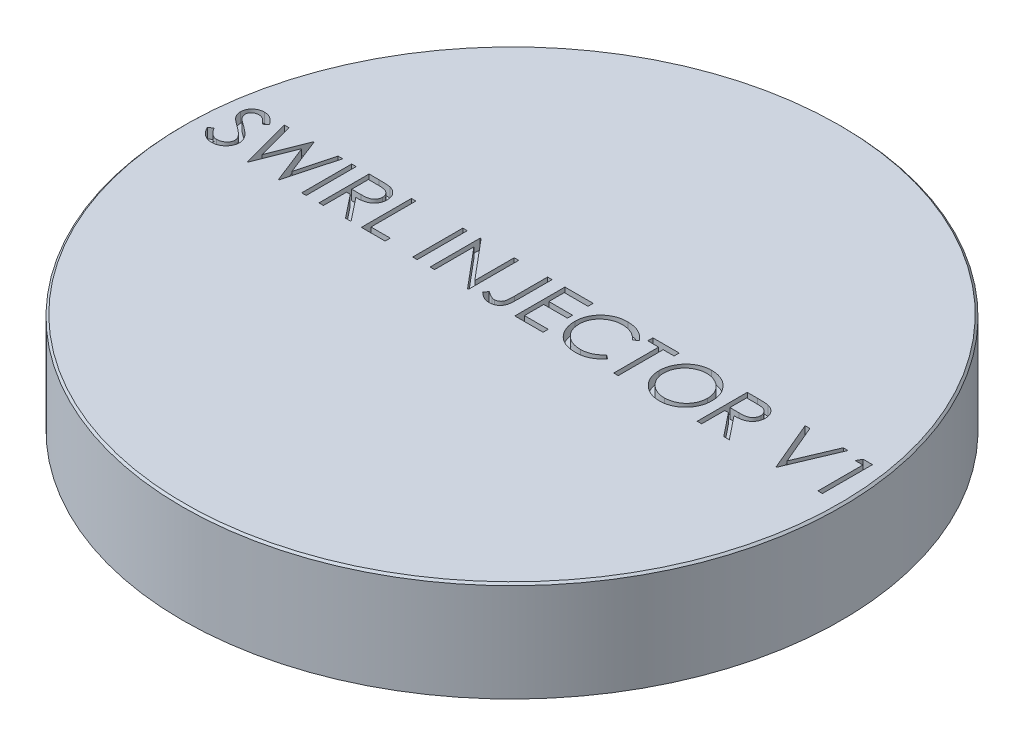
from build123d import *

# Parameters (mm, degrees)
SKETCH3_R           = 4.1783
BOSS_EXTRUDE1_DEPTH = 1.27
CHAMFER1_SIZE       = 0.0254
SKETCH4_W           = 0.056987179
SKETCH4_H           = 0.635
CUT_EXTRUDE1_DEPTH  = 0.127


with BuildPart() as part:
    # Sketch3 → Boss-Extrude1 (new body)
    with BuildSketch(Plane(origin=(0, 0, 0), x_dir=(1, 0, 0), z_dir=(0, 1, 0))):
        Circle(SKETCH3_R)
    extrude(amount=BOSS_EXTRUDE1_DEPTH)

    # Chamfer1
    chamfer1_edges = [part.edges().sort_by_distance(p)[0] for p in [
        (-4.1783, 1.27, 0),
    ]]
    chamfer(chamfer1_edges, length=CHAMFER1_SIZE)

    # Sketch4 → Cut-Extrude1 (cut)
    # profile 1 of 15: a face of its own
    with BuildSketch(Plane(origin=(0, 1.27, 0), x_dir=(1, 0, 0), z_dir=(0, 1, 0))):
        with BuildLine():
            Line((-3.985831527, 0.122496995), (-3.932151639, 0.154679487))
            add(Edge.make_bspline(
                [(-3.932151639, 0.154679487), (-3.927159045, 0.146322092), (-3.917593426, 0.130309644), (-3.901636537, 0.108672828), (-3.885102423, 0.090282837), (-3.867868644, 0.075246653), (-3.850040393, 0.06340864), (-3.831501287, 0.055026235), (-3.812313798, 0.049798194), (-3.79925569, 0.049163178), (-3.792736575, 0.048846154)],
                knots=[0, 0, 0, 0, 1.272034388, 2.437168799, 3.508375237, 4.49857839, 5.41946034, 6.295179144, 7.148887113, 8, 8, 8, 8], degree=3))
            add(Edge.make_bspline(
                [(-3.792736575, 0.048846154), (-3.787169102, 0.049001216), (-3.776131573, 0.049308627), (-3.759882423, 0.052262429), (-3.744101439, 0.056800344), (-3.729113872, 0.063299285), (-3.715126525, 0.071162124), (-3.702860739, 0.080659216), (-3.692256944, 0.091292057), (-3.683583004, 0.103154338), (-3.676928198, 0.115911878), (-3.671813351, 0.129006658), (-3.668974888, 0.142644384), (-3.668547306, 0.151826568), (-3.668331527, 0.156460337)],
                knots=[0, 0, 0, 0, 1.095163259, 2.171163733, 3.241058638, 4.321873601, 5.38011039, 6.391990106, 7.366004449, 8.327778327, 9.272591725, 10.192022065, 11.087607919, 12, 12, 12, 12], degree=3))
            add(Edge.make_bspline(
                [(-3.668331527, 0.156460337), (-3.668599009, 0.161747319), (-3.669142761, 0.172494983), (-3.673738615, 0.188351777), (-3.680968407, 0.204044), (-3.687638201, 0.213750658), (-3.691100958, 0.218790064)],
                knots=[0, 0, 0, 0, 0.938893495, 1.908633276, 2.914225137, 4, 4, 4, 4], degree=3))
            add(Edge.make_bspline(
                [(-3.691100958, 0.218790064), (-3.693944055, 0.222427131), (-3.699912782, 0.230062697), (-3.710173931, 0.241428333), (-3.72221464, 0.25315196), (-3.735622857, 0.265681246), (-3.750887003, 0.278433461), (-3.767528995, 0.292016705), (-3.785973723, 0.30591442), (-3.798909489, 0.315234871), (-3.805584131, 0.320044071)],
                knots=[0, 0, 0, 0, 0.722233717, 1.516239348, 2.393582979, 3.351407094, 4.387010283, 5.505090956, 6.712668013, 8, 8, 8, 8], degree=3))
            add(Edge.make_bspline(
                [(-3.805584131, 0.320044071), (-3.812265056, 0.324802686), (-3.825038476, 0.333900796), (-3.842901676, 0.347403487), (-3.858875457, 0.359748589), (-3.872888822, 0.371052317), (-3.884935606, 0.381316204), (-3.895110739, 0.390441687), (-3.90315502, 0.398675562), (-3.907628247, 0.404017062), (-3.909636615, 0.406415264)],
                knots=[0, 0, 0, 0, 1.452282411, 2.77665338, 3.964542531, 5.026858415, 5.96415736, 6.766646006, 7.446254459, 8, 8, 8, 8], degree=3))
            add(Edge.make_bspline(
                [(-3.909636615, 0.406415264), (-3.912443777, 0.410152881), (-3.917964437, 0.417503406), (-3.925251698, 0.428992344), (-3.931445518, 0.440753137), (-3.93630097, 0.452817387), (-3.940389684, 0.465015724), (-3.943139765, 0.477507307), (-3.944861776, 0.490236085), (-3.945038122, 0.498801963), (-3.945126399, 0.503089944)],
                knots=[0, 0, 0, 0, 1.068054152, 2.10047183, 3.106115577, 4.101338837, 5.06977816, 6.043150881, 7.020423561, 8, 8, 8, 8], degree=3))
            add(Edge.make_bspline(
                [(-3.945126399, 0.503089944), (-3.944889597, 0.509808203), (-3.944421054, 0.523101123), (-3.94045856, 0.542519574), (-3.934204192, 0.56105911), (-3.92544212, 0.578536184), (-3.914146857, 0.594495727), (-3.901075659, 0.609121316), (-3.885507003, 0.621416473), (-3.868425027, 0.632159233), (-3.849727657, 0.640567708), (-3.830135022, 0.646910628), (-3.809615982, 0.650504594), (-3.795717984, 0.651020352), (-3.788666062, 0.651282051)],
                knots=[0, 0, 0, 0, 1.005424448, 1.989358655, 2.955360095, 3.929531133, 4.905563448, 5.876582895, 6.856512386, 7.866279853, 8.892233794, 9.918561126, 10.94386622, 12, 12, 12, 12], degree=3))
            add(Edge.make_bspline(
                [(-3.788666062, 0.651282051), (-3.781183204, 0.65102396), (-3.766302187, 0.650510698), (-3.744412973, 0.646048003), (-3.7233381, 0.638663738), (-3.706384822, 0.630283796), (-3.693116449, 0.621914239), (-3.682997682, 0.614290643), (-3.672743802, 0.605514016), (-3.662272098, 0.595560981), (-3.651760006, 0.584340213), (-3.641051466, 0.57192856), (-3.630121434, 0.55840187), (-3.623090014, 0.548745425), (-3.619485373, 0.543795072)],
                knots=[0, 0, 0, 0, 1.286793592, 2.559021753, 3.825965368, 5.121522368, 5.803751409, 6.523245864, 7.299691795, 8.125521123, 9.008227632, 9.944561021, 10.946284179, 12, 12, 12, 12], degree=3))
            Line((-3.619485373, 0.543795072), (-3.671002801, 0.50474359))
            add(Edge.make_bspline(
                [(-3.671002801, 0.50474359), (-3.674113563, 0.508751109), (-3.680104163, 0.516468655), (-3.689199085, 0.527276594), (-3.697771339, 0.537149298), (-3.706216912, 0.545724542), (-3.714089756, 0.553471929), (-3.721730991, 0.560104914), (-3.729030652, 0.565688486), (-3.738232149, 0.571647246), (-3.749792363, 0.577553926), (-3.764303844, 0.582552116), (-3.779468782, 0.585555677), (-3.789797444, 0.585952804), (-3.795026239, 0.586153846)],
                knots=[0, 0, 0, 0, 1.181633172, 2.275549214, 3.290209073, 4.226197932, 5.078386478, 5.862611352, 6.581680152, 7.217281963, 8.414376989, 9.595101626, 10.782541182, 12, 12, 12, 12], degree=3))
            add(Edge.make_bspline(
                [(-3.795026239, 0.586153846), (-3.801586065, 0.585934009), (-3.814236072, 0.585510074), (-3.832195729, 0.58088002), (-3.848359912, 0.573589882), (-3.862248735, 0.563372736), (-3.873812444, 0.551267642), (-3.882177291, 0.537337764), (-3.887211964, 0.521955814), (-3.887826332, 0.511225827), (-3.888139219, 0.505761218)],
                knots=[0, 0, 0, 0, 1.14458467, 2.207223713, 3.21896685, 4.227309161, 5.202851033, 6.127160689, 7.046193047, 8, 8, 8, 8], degree=3))
            add(Edge.make_bspline(
                [(-3.888139219, 0.505761218), (-3.888067895, 0.502359164), (-3.88792513, 0.495549493), (-3.885933988, 0.485489021), (-3.883375967, 0.475453963), (-3.879322375, 0.465489438), (-3.873726155, 0.455421175), (-3.866377359, 0.445075803), (-3.857122087, 0.434362136), (-3.8500324, 0.427393941), (-3.846289259, 0.423714944)],
                knots=[0, 0, 0, 0, 0.858281714, 1.717966888, 2.583508476, 3.4729293, 4.427298488, 5.488583878, 6.674047936, 8, 8, 8, 8], degree=3))
            add(Edge.make_bspline(
                [(-3.846289259, 0.423714944), (-3.844899268, 0.422474512), (-3.841596965, 0.41952753), (-3.835559761, 0.414702931), (-3.827587282, 0.40875157), (-3.817887712, 0.401387872), (-3.806282205, 0.392845949), (-3.792769485, 0.383235022), (-3.777500178, 0.372243089), (-3.766664916, 0.364558221), (-3.760935694, 0.360494792)],
                knots=[0, 0, 0, 0, 0.420754252, 0.999615792, 1.744751191, 2.668019286, 3.750313428, 4.999500688, 6.413464383, 8, 8, 8, 8], degree=3))
            add(Edge.make_bspline(
                [(-3.760935694, 0.360494792), (-3.754043964, 0.355479859), (-3.740699084, 0.345769138), (-3.721711209, 0.331179436), (-3.704494761, 0.316910484), (-3.688989294, 0.303053403), (-3.675041626, 0.289713307), (-3.662806497, 0.276729701), (-3.652159237, 0.264195604), (-3.640696722, 0.248126008), (-3.628984089, 0.228390012), (-3.618925416, 0.204209531), (-3.612582973, 0.179935056), (-3.611753569, 0.163619758), (-3.611344348, 0.155569912)],
                knots=[0, 0, 0, 0, 1.163667725, 2.253281268, 3.268753668, 4.215851969, 5.092017293, 5.902905408, 6.650798638, 7.335211899, 8.59617414, 9.77448103, 10.901945474, 12, 12, 12, 12], degree=3))
            add(Edge.make_bspline(
                [(-3.611344348, 0.155569912), (-3.611463571, 0.14987698), (-3.611699703, 0.138601669), (-3.61441404, 0.122045391), (-3.618390894, 0.105965219), (-3.624384792, 0.090559917), (-3.631700565, 0.075547653), (-3.640983584, 0.061322219), (-3.651743693, 0.047568773), (-3.664086962, 0.034654054), (-3.677593575, 0.022798387), (-3.691869046, 0.012252114), (-3.706936738, 0.003458575), (-3.722714913, -0.003717077), (-3.739207194, -0.009329301), (-3.756408035, -0.013395636), (-3.774345789, -0.015891315), (-3.786537876, -0.016150352), (-3.792736575, -0.016282051)],
                knots=[0, 0, 0, 0, 0.983748083, 1.948392443, 2.894712957, 3.844097841, 4.80183111, 5.778335162, 6.776009319, 7.81870978, 8.863265674, 9.881300176, 10.883814829, 11.87499822, 12.874611388, 13.892143829, 14.928324115, 16, 16, 16, 16], degree=3))
            add(Edge.make_bspline(
                [(-3.792736575, -0.016282051), (-3.797532702, -0.016189308), (-3.807064552, -0.01600499), (-3.821163273, -0.01437553), (-3.83497717, -0.012070098), (-3.848332904, -0.008409945), (-3.861402548, -0.003969122), (-3.874129261, 0.001498832), (-3.886519209, 0.008051525), (-3.898641828, 0.015543622), (-3.910466285, 0.02426267), (-3.921881674, 0.034417861), (-3.933262541, 0.045729117), (-3.944272969, 0.058503605), (-3.955135668, 0.072534943), (-3.965636465, 0.087954409), (-3.975992719, 0.104678015), (-3.982490668, 0.116446395), (-3.985831527, 0.122496995)],
                knots=[0, 0, 0, 0, 0.915332311, 1.819136955, 2.706846663, 3.586547465, 4.459518054, 5.340707479, 6.227863349, 7.133153174, 8.059268498, 9.028702269, 10.047606654, 11.120612155, 12.245963614, 13.433783089, 14.680604001, 16, 16, 16, 16], degree=3))
        make_face()
    # profile 2 of 15: a face of its own
    with BuildSketch(Plane(origin=(0, 1.27, 0), x_dir=(1, 0, 0), z_dir=(0, 1, 0))):
        Polygon((-3.521793066, 0.635), (-3.462897833, 0.635), (-3.338619989, 0.169307893), (-3.153793266, 0.635), (-3.145525037, 0.635), (-2.964132809, 0.172487981), (-2.839218947, 0.635), (-2.780959732, 0.635), (-2.952175678, 0), (-2.960316703, 0), (-3.151376399, 0.485663061), (-3.344725758, 0), (-3.352866783, 0), align=None)
    # profile 3 of 15: a face of its own
    with BuildSketch(Plane(origin=(0, 1.27, 0), x_dir=(1, 0, 0), z_dir=(0, 1, 0))):
        with Locations((-2.638491784, 0.3175)):
            Rectangle(SKETCH4_W, SKETCH4_H)
    # profile 4 of 15: a face of its own
    with BuildSketch(Plane(origin=(0, 1.27, 0), x_dir=(1, 0, 0), z_dir=(0, 1, 0))):
        with BuildLine():
            Line((-2.447177681, 0.635), (-2.320101359, 0.635))
            add(Edge.make_bspline(
                [(-2.320101359, 0.635), (-2.311621183, 0.634971772), (-2.295338305, 0.634917572), (-2.27201144, 0.634615355), (-2.250815667, 0.63374915), (-2.231762068, 0.633003736), (-2.214850992, 0.631644484), (-2.200030583, 0.630345338), (-2.187369101, 0.628644688), (-2.179704496, 0.627065275), (-2.176234171, 0.62635016)],
                knots=[0, 0, 0, 0, 1.410062039, 2.707475311, 3.878576406, 4.937260626, 5.877586885, 6.699081471, 7.410979367, 8, 8, 8, 8], degree=3))
            add(Edge.make_bspline(
                [(-2.176234171, 0.62635016), (-2.171588398, 0.625202304), (-2.162395959, 0.622931079), (-2.149160732, 0.618130552), (-2.136548848, 0.612575277), (-2.124612694, 0.60605043), (-2.113412058, 0.598507578), (-2.10283145, 0.590076932), (-2.092822859, 0.580804625), (-2.083791048, 0.570456875), (-2.075274963, 0.559600823), (-2.068092455, 0.547861713), (-2.061900937, 0.535585978), (-2.056971429, 0.522648775), (-2.053002139, 0.509175568), (-2.050203379, 0.495044315), (-2.048524949, 0.480319395), (-2.04835407, 0.470275889), (-2.048267425, 0.465183293)],
                knots=[0, 0, 0, 0, 1.027469482, 2.033020251, 3.019912614, 3.986113645, 4.951240523, 5.91722682, 6.890402269, 7.87763091, 8.8651537, 9.85103654, 10.82876324, 11.815024772, 12.821070561, 13.842952187, 14.906261191, 16, 16, 16, 16], degree=3))
            add(Edge.make_bspline(
                [(-2.048267425, 0.465183293), (-2.048533943, 0.456722353), (-2.049053989, 0.440212867), (-2.053902686, 0.41625325), (-2.061844998, 0.393903188), (-2.072789366, 0.373190824), (-2.086726614, 0.354519893), (-2.103476968, 0.338120481), (-2.123049775, 0.32439724), (-2.141270522, 0.314880803), (-2.157365813, 0.308786089), (-2.170616143, 0.304497778), (-2.185070009, 0.301184536), (-2.200588925, 0.298216341), (-2.217237474, 0.295975391), (-2.234975752, 0.29433408), (-2.253816411, 0.293308274), (-2.266759357, 0.29315551), (-2.273417665, 0.293076923)],
                knots=[0, 0, 0, 0, 1.260483769, 2.459530307, 3.627416485, 4.787058657, 5.939039949, 7.08810263, 8.267026773, 9.491475466, 10.141966685, 10.831826277, 11.566392101, 12.351337768, 13.187381173, 14.07005841, 15.007169909, 16, 16, 16, 16], degree=3))
            Line((-2.273417665, 0.293076923), (-2.040126399, 0))
            Line((-2.040126399, 0), (-2.110597152, 0))
            Line((-2.110597152, 0), (-2.343888418, 0.293076923))
            Line((-2.343888418, 0.293076923), (-2.390190501, 0.293076923))
            Line((-2.390190501, 0.293076923), (-2.390190501, 0))
            Line((-2.390190501, 0), (-2.447177681, 0))
            Line((-2.447177681, 0), (-2.447177681, 0.635))
        make_face()
        with BuildLine():
            Line((-2.390190501, 0.569871795), (-2.390190501, 0.358205128))
            Line((-2.390190501, 0.358205128), (-2.273926479, 0.357314704))
            add(Edge.make_bspline(
                [(-2.273926479, 0.357314704), (-2.268498129, 0.357312302), (-2.257976441, 0.357307647), (-2.242754463, 0.358032232), (-2.228581243, 0.35885652), (-2.215510992, 0.36011733), (-2.203537872, 0.361742217), (-2.192667867, 0.363774759), (-2.182883233, 0.366142776), (-2.171471641, 0.369807928), (-2.158728728, 0.375614734), (-2.14488002, 0.384063046), (-2.133086739, 0.394689158), (-2.123123069, 0.406840056), (-2.11511673, 0.420199775), (-2.109472114, 0.434608174), (-2.105890271, 0.449701507), (-2.105467806, 0.460075249), (-2.105254604, 0.465310497)],
                knots=[0, 0, 0, 0, 1.146690395, 2.22261258, 3.21895312, 4.145990853, 4.996080663, 5.770904154, 6.481378293, 7.121626537, 8.300444488, 9.431385265, 10.535395872, 11.636531494, 12.74115979, 13.810798291, 14.895190096, 16, 16, 16, 16], degree=3))
            add(Edge.make_bspline(
                [(-2.105254604, 0.465310497), (-2.105472703, 0.470417089), (-2.105904896, 0.480536493), (-2.109433458, 0.495351208), (-2.115400532, 0.509333355), (-2.123441852, 0.522426054), (-2.133238842, 0.534310666), (-2.144726502, 0.544479221), (-2.15759073, 0.552870195), (-2.169614219, 0.558232204), (-2.180360998, 0.561519663), (-2.189691807, 0.563833089), (-2.20023489, 0.565691728), (-2.212041437, 0.567180905), (-2.225061047, 0.568460873), (-2.239359551, 0.569322982), (-2.254842081, 0.569833497), (-2.265573025, 0.569858732), (-2.271128001, 0.569871795)],
                knots=[0, 0, 0, 0, 1.101028733, 2.181837193, 3.264309656, 4.369019818, 5.486613113, 6.575447106, 7.666700264, 8.788928104, 9.402425223, 10.0903467, 10.862060571, 11.710948788, 12.657782767, 13.684531032, 14.801375019, 16, 16, 16, 16], degree=3))
            Line((-2.271128001, 0.569871795), (-2.390190501, 0.569871795))
        make_face(mode=Mode.SUBTRACT)
    # profile 5 of 15: a face of its own
    with BuildSketch(Plane(origin=(0, 1.27, 0), x_dir=(1, 0, 0), z_dir=(0, 1, 0))):
        Polygon((-1.909869989, 0.635), (-1.852882809, 0.635), (-1.852882809, 0.065128205), (-1.60865204, 0.065128205), (-1.60865204, 0), (-1.909869989, 0), align=None)
    # profile 6 of 15: a face of its own
    with BuildSketch(Plane(origin=(0, 1.27, 0), x_dir=(1, 0, 0), z_dir=(0, 1, 0))):
        with Locations((-1.230094348, 0.3175)):
            Rectangle(SKETCH4_W, SKETCH4_H)
    # profile 7 of 15: a face of its own
    with BuildSketch(Plane(origin=(0, 1.27, 0), x_dir=(1, 0, 0), z_dir=(0, 1, 0))):
        Polygon((-1.038780245, 0), (-1.038780245, 0.635), (-1.026823114, 0.635), (-0.607305886, 0.135217348), (-0.607305886, 0.635), (-0.550318707, 0.635), (-0.550318707, 0), (-0.563293466, 0), (-0.981793066, 0.498637821), (-0.981793066, 0), align=None)
    # profile 8 of 15: a face of its own
    with BuildSketch(Plane(origin=(0, 1.27, 0), x_dir=(1, 0, 0), z_dir=(0, 1, 0))):
        with BuildLine():
            Line((-0.183972553, 0.635), (-0.126985373, 0.635))
            Line((-0.126985373, 0.635), (-0.126985373, 0.206196915))
            add(Edge.make_bspline(
                [(-0.126985373, 0.206196915), (-0.127042327, 0.198267548), (-0.127151685, 0.183042197), (-0.127753014, 0.161112218), (-0.128865802, 0.141087822), (-0.130486869, 0.122923476), (-0.13264954, 0.106676084), (-0.135124412, 0.092220106), (-0.138120305, 0.079676192), (-0.142631793, 0.06559092), (-0.150029352, 0.050143401), (-0.161163086, 0.03346011), (-0.174993893, 0.018867191), (-0.191014224, 0.006193911), (-0.209364095, -0.003903901), (-0.229665629, -0.011152912), (-0.251793853, -0.015574482), (-0.267142567, -0.016041462), (-0.275050277, -0.016282051)],
                knots=[0, 0, 0, 0, 1.237770943, 2.376671248, 3.424123796, 4.367912054, 5.222547132, 5.982086412, 6.656319012, 7.234008312, 8.288027371, 9.317870876, 10.352700517, 11.413286737, 12.494591526, 13.606319346, 14.766767577, 16, 16, 16, 16], degree=3))
            add(Edge.make_bspline(
                [(-0.275050277, -0.016282051), (-0.281211293, -0.016085998), (-0.293607667, -0.015691526), (-0.312057267, -0.0124763), (-0.330454482, -0.00752039), (-0.348896959, -0.000262776), (-0.367749065, 0.009607954), (-0.387266125, 0.022522914), (-0.407699189, 0.038458062), (-0.421158157, 0.050620624), (-0.428203322, 0.056987179)],
                knots=[0, 0, 0, 0, 0.848567217, 1.707373443, 2.573483905, 3.470863513, 4.432650262, 5.500696352, 6.691726801, 8, 8, 8, 8], degree=3))
            Line((-0.428203322, 0.056987179), (-0.394621591, 0.105833333))
            add(Edge.make_bspline(
                [(-0.394621591, 0.105833333), (-0.386874105, 0.100490734), (-0.372245841, 0.090403211), (-0.35074575, 0.077426242), (-0.331696266, 0.066300105), (-0.319235217, 0.060630048), (-0.313465742, 0.058004808)],
                knots=[0, 0, 0, 0, 1.196737151, 2.259595785, 3.194191475, 4, 4, 4, 4], degree=3))
            add(Edge.make_bspline(
                [(-0.313465742, 0.058004808), (-0.309967017, 0.056633306), (-0.303105238, 0.053943486), (-0.292614116, 0.050941588), (-0.282182874, 0.049301036), (-0.275267235, 0.048995994), (-0.271870189, 0.048846154)],
                knots=[0, 0, 0, 0, 1.051806502, 2.062826769, 3.048436908, 4, 4, 4, 4], degree=3))
            add(Edge.make_bspline(
                [(-0.271870189, 0.048846154), (-0.26748274, 0.049031707), (-0.258810372, 0.049398478), (-0.246207618, 0.052636846), (-0.234150233, 0.057579759), (-0.223070452, 0.06481718), (-0.212858675, 0.073422595), (-0.204432619, 0.083828613), (-0.197408205, 0.095361299), (-0.193180975, 0.10627812), (-0.190487709, 0.116234309), (-0.188778357, 0.12538432), (-0.187283628, 0.136081617), (-0.18598069, 0.148338968), (-0.185217879, 0.162180912), (-0.18436203, 0.177566807), (-0.184052647, 0.194535442), (-0.184000066, 0.206366572), (-0.183972553, 0.212557091)],
                knots=[0, 0, 0, 0, 0.997221856, 1.971139923, 2.944579524, 3.951425367, 4.971190333, 5.972282193, 6.985401279, 8.033996657, 8.624075553, 9.332086008, 10.151144245, 11.082816738, 12.137127781, 13.306538797, 14.590673636, 16, 16, 16, 16], degree=3))
            Line((-0.183972553, 0.212557091), (-0.183972553, 0.635))
        make_face()
    # profile 9 of 15: a face of its own
    with BuildSketch(Plane(origin=(0, 1.27, 0), x_dir=(1, 0, 0), z_dir=(0, 1, 0))):
        Polygon((0.03583514, 0.635), (0.394040268, 0.635), (0.394040268, 0.569871795), (0.092822319, 0.569871795), (0.092822319, 0.374487179), (0.394040268, 0.374487179), (0.394040268, 0.309358974), (0.092822319, 0.309358974), (0.092822319, 0.065128205), (0.394040268, 0.065128205), (0.394040268, 0), (0.03583514, 0), align=None)
    # profile 10 of 15: a face of its own
    with BuildSketch(Plane(origin=(0, 1.27, 0), x_dir=(1, 0, 0), z_dir=(0, 1, 0))):
        with BuildLine():
            Line((1.094168473, 0.518481571), (1.044304691, 0.480320513))
            add(Edge.make_bspline(
                [(1.044304691, 0.480320513), (1.040747623, 0.484559767), (1.033681443, 0.492981122), (1.022313273, 0.504806554), (1.01046569, 0.515885537), (0.99814322, 0.526270849), (0.985124066, 0.53559932), (0.971723607, 0.544357077), (0.957717676, 0.552207081), (0.938349861, 0.561725365), (0.913013751, 0.571657882), (0.881119545, 0.57998604), (0.847825388, 0.585287596), (0.825110967, 0.585861789), (0.813557495, 0.586153846)],
                knots=[0, 0, 0, 0, 0.757959112, 1.505699292, 2.245454638, 2.979532153, 3.711538275, 4.438200793, 5.171680507, 5.909471876, 7.393775596, 8.890124382, 10.418191784, 12, 12, 12, 12], degree=3))
            add(Edge.make_bspline(
                [(0.813557495, 0.586153846), (0.807192382, 0.586080556), (0.794521231, 0.585934655), (0.775716436, 0.584009857), (0.757262783, 0.581304537), (0.739172274, 0.577290372), (0.721467937, 0.572215339), (0.70403403, 0.566151014), (0.687122964, 0.558648065), (0.670500798, 0.55035528), (0.654575141, 0.540988587), (0.639506583, 0.530771736), (0.62535008, 0.519819057), (0.612094434, 0.508089499), (0.599726095, 0.495635886), (0.588334683, 0.482325498), (0.577959616, 0.46820089), (0.568395241, 0.453448315), (0.559829503, 0.438110744), (0.552657653, 0.42213141), (0.546306724, 0.405783951), (0.54128129, 0.388883669), (0.537303556, 0.371549481), (0.534558966, 0.353734867), (0.532656057, 0.335477042), (0.532510882, 0.323101924), (0.532437704, 0.316863982)],
                knots=[0, 0, 0, 0, 1.054917814, 2.100044995, 3.131103042, 4.146048494, 5.169673617, 6.183595914, 7.203665975, 8.234915748, 9.262203917, 10.264457458, 11.251630812, 12.227803204, 13.197192746, 14.159520551, 15.12972552, 16.100847026, 17.073214652, 18.039054194, 19.002613845, 19.979014051, 20.95965708, 21.949030935, 22.966165397, 24, 24, 24, 24], degree=3))
            add(Edge.make_bspline(
                [(0.532437704, 0.316863982), (0.532666634, 0.307478443), (0.533116107, 0.289051181), (0.537116305, 0.262059942), (0.543195086, 0.236202619), (0.552305626, 0.211640848), (0.563539511, 0.18807176), (0.577734594, 0.16589414), (0.594175023, 0.144772849), (0.613093382, 0.125207057), (0.633849865, 0.107333852), (0.656119844, 0.091594818), (0.67984785, 0.078474832), (0.704771896, 0.067557196), (0.731083777, 0.059164904), (0.758736176, 0.053256842), (0.787668953, 0.049402904), (0.807439115, 0.049033934), (0.817500805, 0.048846154)],
                knots=[0, 0, 0, 0, 1.029171465, 2.020641659, 2.987623507, 3.938342917, 4.889210282, 5.84687017, 6.821220943, 7.821438502, 8.827599549, 9.822697543, 10.807740252, 11.797342354, 12.80366471, 13.83203677, 14.896651826, 16, 16, 16, 16], degree=3))
            add(Edge.make_bspline(
                [(0.817500805, 0.048846154), (0.828586578, 0.049152547), (0.850406033, 0.049755601), (0.882404232, 0.054864494), (0.913035863, 0.063148144), (0.942302576, 0.074741053), (0.970121861, 0.08981147), (0.996537255, 0.108080942), (1.021571055, 0.129723254), (1.036624416, 0.146248335), (1.044304691, 0.154679487)],
                knots=[0, 0, 0, 0, 1.028121516, 2.023589091, 2.998037872, 3.967518031, 4.937445131, 5.927275754, 6.942489185, 8, 8, 8, 8], degree=3))
            Line((1.044304691, 0.154679487), (1.094168473, 0.11690004))
            add(Edge.make_bspline(
                [(1.094168473, 0.11690004), (1.090155616, 0.11172235), (1.082149123, 0.101391769), (1.069184597, 0.086828188), (1.055527145, 0.073129598), (1.041075323, 0.060406444), (1.025995381, 0.048404134), (1.010016547, 0.037463659), (0.99334888, 0.027432313), (0.976048853, 0.018247142), (0.958134847, 0.01009787), (0.939628328, 0.003121258), (0.920609067, -0.002888543), (0.901076193, -0.007832823), (0.880989192, -0.011692006), (0.860420548, -0.014271861), (0.839325871, -0.016039323), (0.825094356, -0.016200416), (0.817882415, -0.016282051)],
                knots=[0, 0, 0, 0, 0.986787822, 1.968848986, 2.935600012, 3.899624008, 4.868462664, 5.837806735, 6.815139263, 7.798259679, 8.787526145, 9.778297419, 10.776456485, 11.791383307, 12.812564526, 13.85620153, 14.913611965, 16, 16, 16, 16], degree=3))
            add(Edge.make_bspline(
                [(0.817882415, -0.016282051), (0.811052778, -0.016234518), (0.797548018, -0.016140528), (0.777609244, -0.014617949), (0.758198277, -0.012540639), (0.739370595, -0.009412787), (0.721023454, -0.005721743), (0.703323176, -0.000773957), (0.686095588, 0.004768534), (0.669409904, 0.011282725), (0.65325193, 0.018633518), (0.637673781, 0.026941415), (0.622682622, 0.036136553), (0.608131068, 0.046016248), (0.594234077, 0.056897844), (0.580871223, 0.068630219), (0.567967574, 0.08117383), (0.55998423, 0.090218925), (0.555970356, 0.094766627)],
                knots=[0, 0, 0, 0, 1.114604814, 2.203992996, 3.262667896, 4.300477797, 5.318619304, 6.316056647, 7.298880507, 8.271930387, 9.238335007, 10.195173496, 11.151986948, 12.108099108, 13.064862484, 14.031167946, 15.010108607, 16, 16, 16, 16], degree=3))
            add(Edge.make_bspline(
                [(0.555970356, 0.094766627), (0.549541318, 0.102666242), (0.536760858, 0.118370103), (0.520409484, 0.143821988), (0.506412714, 0.170395506), (0.495095939, 0.198230264), (0.486248986, 0.227263804), (0.480120112, 0.257510762), (0.476137464, 0.288942889), (0.475682026, 0.310321849), (0.475450524, 0.321188902)],
                knots=[0, 0, 0, 0, 0.994628077, 1.977248131, 2.950237994, 3.925870899, 4.908910175, 5.911660606, 6.938484602, 8, 8, 8, 8], degree=3))
            add(Edge.make_bspline(
                [(0.475450524, 0.321188902), (0.475732681, 0.33261082), (0.476287806, 0.355082731), (0.481004186, 0.38806172), (0.488591311, 0.419657759), (0.499367603, 0.449811867), (0.513030146, 0.478682646), (0.529907831, 0.506049551), (0.549804584, 0.532087599), (0.572564357, 0.556401704), (0.597523002, 0.578633843), (0.624250844, 0.598192969), (0.652695569, 0.614470289), (0.682543808, 0.628076736), (0.714019067, 0.638535089), (0.747054193, 0.64585631), (0.78158711, 0.650413272), (0.805147864, 0.650989346), (0.817119194, 0.651282051)],
                knots=[0, 0, 0, 0, 1.032925535, 2.032216505, 3.007276963, 3.968222605, 4.92396291, 5.891752235, 6.871517503, 7.883894988, 8.900124299, 9.891468569, 10.874487609, 11.85992873, 12.854644235, 13.869047385, 14.917252991, 16, 16, 16, 16], degree=3))
            add(Edge.make_bspline(
                [(0.817119194, 0.651282051), (0.824415248, 0.651194578), (0.838857053, 0.651021432), (0.860220748, 0.649333032), (0.881020142, 0.646518421), (0.901269563, 0.642687363), (0.921067523, 0.637932606), (0.94026271, 0.63173858), (0.958967757, 0.624656238), (0.977064696, 0.616499488), (0.994466699, 0.607343379), (1.011168345, 0.597289401), (1.02703697, 0.58635002), (1.042184232, 0.574618272), (1.056356745, 0.561845962), (1.069956899, 0.548384398), (1.082522837, 0.533845833), (1.090279488, 0.523612366), (1.094168473, 0.518481571)],
                knots=[0, 0, 0, 0, 1.096760587, 2.17092713, 3.219439832, 4.250915756, 5.268269357, 6.278326846, 7.281116186, 8.274029601, 9.260640565, 10.235837813, 11.203064059, 12.156899882, 13.114053108, 14.069676657, 15.032185724, 16, 16, 16, 16], degree=3))
        make_face()
    # profile 11 of 15: a face of its own
    with BuildSketch(Plane(origin=(0, 1.27, 0), x_dir=(1, 0, 0), z_dir=(0, 1, 0))):
        Polygon((1.151155652, 0.569871795), (1.151155652, 0.635), (1.484937704, 0.635), (1.484937704, 0.569871795), (1.346540268, 0.569871795), (1.346540268, 0), (1.289553088, 0), (1.289553088, 0.569871795), align=None)
    # profile 12 of 15: a face of its own
    with BuildSketch(Plane(origin=(0, 1.27, 0), x_dir=(1, 0, 0), z_dir=(0, 1, 0))):
        with BuildLine():
            add(Edge.make_bspline(
                [(1.879777447, 0.651282051), (1.891535489, 0.65098424), (1.914629254, 0.650399314), (1.948569986, 0.64592182), (1.980972239, 0.638175656), (2.012099964, 0.627859086), (2.041580832, 0.614096934), (2.069636746, 0.597462628), (2.09620095, 0.577781899), (2.120915401, 0.555206882), (2.143531733, 0.530644456), (2.163457287, 0.504432035), (2.180156388, 0.476728109), (2.19386981, 0.44761593), (2.204628272, 0.417161336), (2.212052156, 0.385201967), (2.216794363, 0.351944896), (2.217348768, 0.32926145), (2.217630011, 0.317754407)],
                knots=[0, 0, 0, 0, 1.065120563, 2.091984664, 3.0946048, 4.079830382, 5.057816894, 6.036188127, 7.030412546, 8.04752943, 9.064399622, 10.05169764, 11.02544977, 11.989514704, 12.962713494, 13.945757189, 14.957906945, 16, 16, 16, 16], degree=3))
            add(Edge.make_bspline(
                [(2.217630011, 0.317754407), (2.217348809, 0.306332127), (2.216794528, 0.283817491), (2.212046764, 0.250771466), (2.204600754, 0.219005011), (2.193969717, 0.188571157), (2.180321666, 0.159437799), (2.16351137, 0.131681595), (2.143710036, 0.105293444), (2.121175365, 0.080562432), (2.096609747, 0.05788432), (2.070260827, 0.038123324), (2.042721182, 0.02111909), (2.013636421, 0.007551195), (1.983392271, -0.00329314), (1.95171805, -0.010686831), (1.918762175, -0.015456052), (1.896288436, -0.016003697), (1.884865588, -0.016282051)],
                knots=[0, 0, 0, 0, 1.043624062, 2.057103931, 3.04512605, 4.022047818, 4.998200453, 5.980619268, 6.982898556, 8.009068085, 9.034988726, 10.034168286, 11.015286542, 11.987931943, 12.962482838, 13.94673481, 14.956375938, 16, 16, 16, 16], degree=3))
            add(Edge.make_bspline(
                [(1.884865588, -0.016282051), (1.873358605, -0.016000948), (1.850675277, -0.015446819), (1.817376415, -0.010696764), (1.785394596, -0.003268842), (1.754821278, 0.007346441), (1.725639412, 0.021065567), (1.697791925, 0.037794076), (1.671390594, 0.057643657), (1.646654306, 0.080171022), (1.624021237, 0.104695003), (1.604289179, 0.130972075), (1.587556909, 0.158486708), (1.573883847, 0.187315259), (1.563059009, 0.217318364), (1.555673992, 0.248696159), (1.550895898, 0.281269755), (1.55034529, 0.303448109), (1.550065909, 0.314701522)],
                knots=[0, 0, 0, 0, 1.053102029, 2.075944431, 3.073151272, 4.055350789, 5.033113405, 6.020478099, 7.024410459, 8.052272461, 9.079885166, 10.07527673, 11.055994387, 12.023226415, 12.992069828, 13.970394897, 14.97016774, 16, 16, 16, 16], degree=3))
            add(Edge.make_bspline(
                [(1.550065909, 0.314701522), (1.550162907, 0.322254878), (1.55035568, 0.337266301), (1.552676458, 0.359557812), (1.556044081, 0.381490832), (1.560870428, 0.403002989), (1.56718263, 0.424041625), (1.574630641, 0.444751835), (1.583727442, 0.464923739), (1.594010931, 0.484652897), (1.60548843, 0.50363176), (1.618165888, 0.521571342), (1.631598019, 0.53862218), (1.646323377, 0.554342422), (1.661856647, 0.569189385), (1.678449809, 0.582934907), (1.696001617, 0.595702934), (1.714587591, 0.607209195), (1.733749764, 0.617615781), (1.753503122, 0.626546031), (1.773579386, 0.634210674), (1.794072586, 0.640422938), (1.814928304, 0.645327322), (1.836192056, 0.648666942), (1.857846903, 0.650993639), (1.872435814, 0.6511855), (1.879777447, 0.651282051)],
                knots=[0, 0, 0, 0, 1.037015668, 2.060948919, 3.074880161, 4.083647147, 5.086022904, 6.090072063, 7.104153813, 8.122640571, 9.144368836, 10.147691507, 11.138137339, 12.123020368, 13.103399296, 14.087645067, 15.080126199, 16.082011238, 17.087798457, 18.072939717, 19.057185487, 20.037253025, 21.01195951, 21.997135196, 22.992090687, 24, 24, 24, 24], degree=3))
        make_face()
        with BuildLine():
            add(Edge.make_bspline(
                [(1.882575925, 0.586153846), (1.876549841, 0.586080387), (1.864555284, 0.585934172), (1.846723661, 0.584008178), (1.829126553, 0.581263184), (1.811760326, 0.57734768), (1.794697642, 0.572012944), (1.777779457, 0.565873237), (1.761160045, 0.558394553), (1.744894274, 0.549944934), (1.729125396, 0.540592487), (1.714245949, 0.530256181), (1.700217412, 0.519178414), (1.687074134, 0.507333335), (1.674854707, 0.494660622), (1.663318625, 0.481352394), (1.652928287, 0.467028265), (1.643405903, 0.452076663), (1.634884595, 0.436517062), (1.627307167, 0.420513272), (1.621108839, 0.403934749), (1.616053808, 0.386961352), (1.611862843, 0.369619963), (1.609207831, 0.35177903), (1.607260674, 0.333528203), (1.607122816, 0.321194352), (1.607053088, 0.314955929)],
                knots=[0, 0, 0, 0, 1.008559885, 2.007477868, 2.99961109, 3.989939068, 4.984837346, 5.991145699, 7.001802488, 8.033829008, 9.059044045, 10.069351652, 11.065060232, 12.050310815, 13.029377138, 14.011219647, 14.996725999, 15.989392538, 16.977580475, 17.965360261, 18.951710183, 19.937753436, 20.929683414, 21.935841486, 22.955955122, 24, 24, 24, 24], degree=3))
            add(Edge.make_bspline(
                [(1.607053088, 0.314955929), (1.607284385, 0.305782498), (1.607739416, 0.28773552), (1.611723147, 0.261289014), (1.617859419, 0.235872997), (1.62690497, 0.211626536), (1.638217153, 0.188341216), (1.652192032, 0.166223603), (1.668749037, 0.145267718), (1.687556563, 0.125619862), (1.70811654, 0.107686409), (1.729948335, 0.091945048), (1.752818061, 0.078626331), (1.776785356, 0.067775983), (1.801722267, 0.05917813), (1.82778948, 0.053285578), (1.854813349, 0.04940746), (1.87323391, 0.049035032), (1.882575925, 0.048846154)],
                knots=[0, 0, 0, 0, 1.032063989, 2.030389145, 3.003944642, 3.970395727, 4.937377036, 5.913328081, 6.909231446, 7.93887556, 8.970685674, 9.976071282, 10.964166581, 11.944589148, 12.933237628, 13.927779006, 14.949070134, 16, 16, 16, 16], degree=3))
            add(Edge.make_bspline(
                [(1.882575925, 0.048846154), (1.888855077, 0.048932424), (1.901308522, 0.049103523), (1.919831567, 0.050826855), (1.938020908, 0.053590351), (1.955851034, 0.057569199), (1.973301706, 0.062548906), (1.990445764, 0.06846488), (2.007100596, 0.075845612), (2.02347631, 0.084000455), (2.039151056, 0.093296883), (2.054114474, 0.103282376), (2.067989402, 0.114343826), (2.081122848, 0.126012915), (2.093392443, 0.138524927), (2.104715216, 0.151863596), (2.11505304, 0.166113115), (2.124571807, 0.181042039), (2.133063256, 0.196644216), (2.14046175, 0.212706029), (2.146738474, 0.229187928), (2.151805503, 0.246113684), (2.155776151, 0.263451152), (2.158512079, 0.281223547), (2.160425867, 0.299395313), (2.160570117, 0.311685984), (2.160642832, 0.317881611)],
                knots=[0, 0, 0, 0, 1.047197238, 2.076906641, 3.100256066, 4.114471768, 5.12198147, 6.126382909, 7.136867548, 8.15857795, 9.17633901, 10.174870724, 11.156907918, 12.133735059, 13.104061851, 14.077631395, 15.04955518, 16.038496417, 17.029181396, 18.010275684, 18.986308667, 19.968651475, 20.955262928, 21.950658345, 22.966943676, 24, 24, 24, 24], degree=3))
            add(Edge.make_bspline(
                [(2.160642832, 0.317881611), (2.160570059, 0.324034852), (2.160425699, 0.33624094), (2.158512993, 0.354285974), (2.15577326, 0.371930485), (2.151824883, 0.389105204), (2.146735784, 0.405814508), (2.140460654, 0.422042703), (2.133061035, 0.437850247), (2.124568686, 0.45319807), (2.115022672, 0.467925487), (2.104591574, 0.482004781), (2.093095289, 0.49517155), (2.080862282, 0.507750845), (2.067586993, 0.519474376), (2.053329556, 0.530346033), (2.038263061, 0.540628185), (2.022310548, 0.549903822), (2.005847002, 0.558469833), (1.98895347, 0.565808801), (1.971821333, 0.572044885), (1.954494158, 0.57736382), (1.936826104, 0.581247849), (1.918936552, 0.584010652), (1.900850254, 0.585933502), (1.888686698, 0.586080165), (1.882575925, 0.586153846)],
                knots=[0, 0, 0, 0, 1.02996197, 2.043119294, 3.035359645, 4.018872909, 4.991431989, 5.957985074, 6.929999688, 7.912076566, 8.892894881, 9.867085534, 10.843653904, 11.817741046, 12.803660682, 13.806313499, 14.818574707, 15.856120519, 16.894564902, 17.924820532, 18.937903209, 19.946497019, 20.957711757, 21.963978472, 22.977135795, 24, 24, 24, 24], degree=3))
        make_face(mode=Mode.SUBTRACT)
    # profile 13 of 15: a face of its own
    with BuildSketch(Plane(origin=(0, 1.27, 0), x_dir=(1, 0, 0), z_dir=(0, 1, 0))):
        with BuildLine():
            Line((2.347886422, 0.635), (2.474962744, 0.635))
            add(Edge.make_bspline(
                [(2.474962744, 0.635), (2.48344292, 0.634971772), (2.499725798, 0.634917572), (2.523052662, 0.634615355), (2.544248436, 0.63374915), (2.563302035, 0.633003736), (2.580213111, 0.631644484), (2.595033519, 0.630345338), (2.607695002, 0.628644688), (2.615359606, 0.627065275), (2.618829931, 0.62635016)],
                knots=[0, 0, 0, 0, 1.410062039, 2.707475311, 3.878576406, 4.937260626, 5.877586885, 6.699081471, 7.410979367, 8, 8, 8, 8], degree=3))
            add(Edge.make_bspline(
                [(2.618829931, 0.62635016), (2.623475704, 0.625202304), (2.632668144, 0.622931079), (2.64590337, 0.618130552), (2.658515255, 0.612575277), (2.670451409, 0.60605043), (2.681652045, 0.598507578), (2.692232653, 0.590076932), (2.702241244, 0.580804625), (2.711273054, 0.570456875), (2.719789139, 0.559600823), (2.726971647, 0.547861713), (2.733163166, 0.535585978), (2.738092674, 0.522648775), (2.742061963, 0.509175568), (2.744860724, 0.495044315), (2.746539153, 0.480319395), (2.746710033, 0.470275889), (2.746796678, 0.465183293)],
                knots=[0, 0, 0, 0, 1.027469482, 2.033020251, 3.019912614, 3.986113645, 4.951240523, 5.91722682, 6.890402269, 7.87763091, 8.8651537, 9.85103654, 10.82876324, 11.815024772, 12.821070561, 13.842952187, 14.906261191, 16, 16, 16, 16], degree=3))
            add(Edge.make_bspline(
                [(2.746796678, 0.465183293), (2.74653016, 0.456722353), (2.746010114, 0.440212867), (2.741161416, 0.41625325), (2.733219105, 0.393903188), (2.722274737, 0.373190824), (2.708337489, 0.354519893), (2.691587134, 0.338120481), (2.672014327, 0.32439724), (2.65379358, 0.314880803), (2.63769829, 0.308786089), (2.62444796, 0.304497778), (2.609994094, 0.301184536), (2.594475178, 0.298216341), (2.577826629, 0.295975391), (2.56008835, 0.29433408), (2.541247691, 0.293308274), (2.528304746, 0.29315551), (2.521646438, 0.293076923)],
                knots=[0, 0, 0, 0, 1.260483769, 2.459530307, 3.627416485, 4.787058657, 5.939039949, 7.08810263, 8.267026773, 9.491475466, 10.141966685, 10.831826277, 11.566392101, 12.351337768, 13.187381173, 14.07005841, 15.007169909, 16, 16, 16, 16], degree=3))
            Line((2.521646438, 0.293076923), (2.754937704, 0))
            Line((2.754937704, 0), (2.68446695, 0))
            Line((2.68446695, 0), (2.451175684, 0.293076923))
            Line((2.451175684, 0.293076923), (2.404873601, 0.293076923))
            Line((2.404873601, 0.293076923), (2.404873601, 0))
            Line((2.404873601, 0), (2.347886422, 0))
            Line((2.347886422, 0), (2.347886422, 0.635))
        make_face()
        with BuildLine():
            Line((2.404873601, 0.569871795), (2.404873601, 0.358205128))
            Line((2.404873601, 0.358205128), (2.521137624, 0.357314704))
            add(Edge.make_bspline(
                [(2.521137624, 0.357314704), (2.526565973, 0.357312302), (2.537087662, 0.357307647), (2.552309639, 0.358032232), (2.56648286, 0.35885652), (2.57955311, 0.36011733), (2.591526231, 0.361742217), (2.602396236, 0.363774759), (2.612180869, 0.366142776), (2.623592461, 0.369807928), (2.636335375, 0.375614734), (2.650184082, 0.384063046), (2.661977364, 0.394689158), (2.671941033, 0.406840056), (2.679947373, 0.420199775), (2.685591988, 0.434608174), (2.689173831, 0.449701507), (2.689596296, 0.460075249), (2.689809499, 0.465310497)],
                knots=[0, 0, 0, 0, 1.146690395, 2.22261258, 3.21895312, 4.145990853, 4.996080663, 5.770904154, 6.481378293, 7.121626537, 8.300444488, 9.431385265, 10.535395872, 11.636531494, 12.74115979, 13.810798291, 14.895190096, 16, 16, 16, 16], degree=3))
            add(Edge.make_bspline(
                [(2.689809499, 0.465310497), (2.689591399, 0.470417089), (2.689159207, 0.480536493), (2.685630644, 0.495351208), (2.679663571, 0.509333355), (2.671622251, 0.522426054), (2.661825261, 0.534310666), (2.650337601, 0.544479221), (2.637473372, 0.552870195), (2.625449884, 0.558232204), (2.614703105, 0.561519663), (2.605372295, 0.563833089), (2.594829213, 0.565691728), (2.583022665, 0.567180905), (2.570003055, 0.568460873), (2.555704551, 0.569322982), (2.540222021, 0.569833497), (2.529491078, 0.569858732), (2.523936101, 0.569871795)],
                knots=[0, 0, 0, 0, 1.101028733, 2.181837193, 3.264309656, 4.369019818, 5.486613113, 6.575447106, 7.666700264, 8.788928104, 9.402425223, 10.0903467, 10.862060571, 11.710948788, 12.657782767, 13.684531032, 14.801375019, 16, 16, 16, 16], degree=3))
            Line((2.523936101, 0.569871795), (2.404873601, 0.569871795))
        make_face(mode=Mode.SUBTRACT)
    # profile 14 of 15: a face of its own
    with BuildSketch(Plane(origin=(0, 1.27, 0), x_dir=(1, 0, 0), z_dir=(0, 1, 0))):
        Polygon((3.080578729, 0.635), (3.141636422, 0.635), (3.353303088, 0.13458133), (3.564969755, 0.635), (3.626027447, 0.635), (3.357373601, 0), (3.349232575, 0), align=None)
    # profile 15 of 15: a face of its own
    with BuildSketch(Plane(origin=(0, 1.27, 0), x_dir=(1, 0, 0), z_dir=(0, 1, 0))):
        Polygon((3.817977567, 0.635), (3.935386422, 0.635), (3.935386422, 0), (3.878399242, 0), (3.878399242, 0.569871795), (3.780706934, 0.569871795), align=None)
    extrude(amount=-CUT_EXTRUDE1_DEPTH, mode=Mode.SUBTRACT)


solid = part.part
